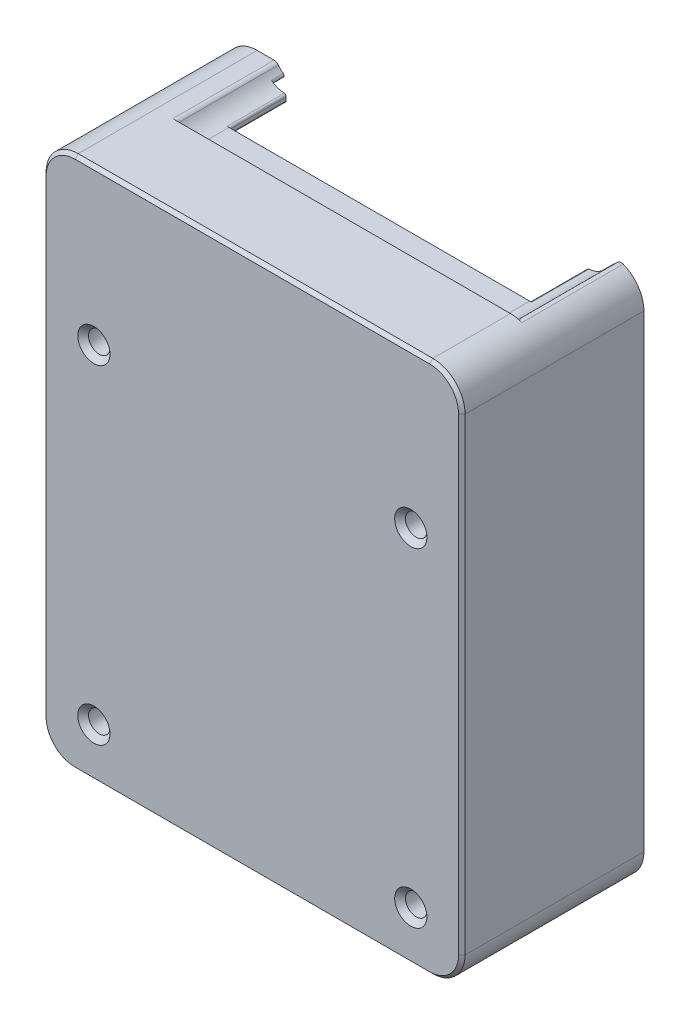
from build123d import *

# Parameters (mm, degrees)
EXTRUDE_1_DEPTH     = 2.45
EXTRUDE_START       = 13.5
SKETCH_2_R          = 1
EXTRUDE_2_DEPTH     = 13.5
EXTRUDE_START_2     = 1
SKETCH_3_R          = 1
EXTRUDE_3_DEPTH     = 1
SKETCH_4_W          = 23.9
SKETCH_4_H          = 5.2
CUT_EXTRUDE_1_DEPTH = 4
SKETCH_5_W          = 28
SKETCH_5_H          = 6.8
CUT_EXTRUDE_2_DEPTH = 4
SKETCH_6_R          = 1
CUT_EXTRUDE_3_DEPTH = 10
SKETCH_8_R          = 1
EXTRUDE_4_DEPTH     = 6
EXTRUDE_1_2_REACH   = 64.345
SKETCH_14_W         = 28
SKETCH_14_H         = 0.1
EXTRUDE_2_2_DEPTH   = 9.523664952
SKETCH_15_W         = 23.9
SKETCH_15_H         = 0.1
EXTRUDE_3_2_DEPTH   = 11.15
EXTRUDE_5_REACH     = 64.055
SKETCH_12_W         = 28
SKETCH_12_H         = 1.8
EXTRUDE_6_DEPTH     = 9.523664952
CUT_EXTRUDE_4_DEPTH = 9.426335048
FILLET_1_R          = 0.5
FILLET_2_R          = 0.2
FILLET_3_R          = 1.5
FILLET_4_R          = 2
CHAMFER_1_SIZE      = 0.3
CHAMFER_2_SIZE      = 0.5


with BuildPart() as part:
    # Эскиз1 → Extrude 1 (new body)
    with BuildSketch(Plane.XY):
        with BuildLine():
            Line((33.90958774, -47.3), (0.90958774, -47.3))
            ThreePointArc((0.90958774, -47.3), (-1.211732603, -46.421320344), (-2.09041226, -44.3))
            Line((-2.09041226, -44.3), (-2.09041226, -0.7))
            ThreePointArc((-2.09041226, -0.7), (-1.211732603, 1.421320344), (0.90958774, 2.3))
            Line((0.90958774, 2.3), (33.90958774, 2.3))
            ThreePointArc((33.90958774, 2.3), (36.030908084, 1.421320344), (36.90958774, -0.7))
            Line((36.90958774, -0.7), (36.90958774, -44.3))
            ThreePointArc((36.90958774, -44.3), (36.030908084, -46.421320344), (33.90958774, -47.3))
        make_face()
        with BuildLine():
            Line((33.80958774, -46.4), (1.00958774, -46.4))
            ThreePointArc((1.00958774, -46.4), (-0.546047178, -45.755634919), (-1.19041226, -44.2))
            Line((-1.19041226, -44.2), (-1.19041226, -0.8))
            ThreePointArc((-1.19041226, -0.8), (-0.546047178, 0.755634919), (1.00958774, 1.4))
            Line((1.00958774, 1.4), (33.80958774, 1.4))
            ThreePointArc((33.80958774, 1.4), (35.365222659, 0.755634919), (36.00958774, -0.8))
            Line((36.00958774, -0.8), (36.00958774, -44.2))
            ThreePointArc((36.00958774, -44.2), (35.365222659, -45.755634919), (33.80958774, -46.4))
        make_face(mode=Mode.SUBTRACT)
    extrude(amount=-EXTRUDE_1_DEPTH)

    # Эскиз2 → Extrude 2 (add)
    with BuildSketch(Plane.XY.offset(EXTRUDE_START)):
        with BuildLine():
            ThreePointArc((-2.09041226, -44.3), (-1.211732603, -46.421320344), (0.90958774, -47.3))
            Line((0.90958774, -47.3), (33.90958774, -47.3))
            ThreePointArc((33.90958774, -47.3), (36.030908084, -46.421320344), (36.90958774, -44.3))
            Line((36.90958774, -44.3), (36.90958774, -0.7))
            ThreePointArc((36.90958774, -0.7), (36.030908084, 1.421320344), (33.90958774, 2.3))
            Line((33.90958774, 2.3), (0.90958774, 2.3))
            ThreePointArc((0.90958774, 2.3), (-1.211732603, 1.421320344), (-2.09041226, -0.7))
            Line((-2.09041226, -0.7), (-2.09041226, -39.9))
            Line((-2.09041226, -39.9), (-2.09041226, -44.3))
        make_face()
        with Locations((2.65958774, -42.7)):
            Circle(SKETCH_2_R, mode=Mode.SUBTRACT)
        with Locations((2.65958774, -12.1)):
            Circle(SKETCH_2_R, mode=Mode.SUBTRACT)
        with BuildLine():
            Line((2.65958774, -39.9), (-1.19041226, -39.9))
            Line((-1.19041226, -39.9), (-1.19041226, -14.9))
            Line((-1.19041226, -14.9), (2.65958774, -14.9))
            ThreePointArc((2.65958774, -14.9), (5.45958774, -12.1), (2.65958774, -9.3))
            Line((2.65958774, -9.3), (-1.19041226, -9.3))
            Line((-1.19041226, -9.3), (-1.19041226, -0.8))
            ThreePointArc((-1.19041226, -0.8), (-0.546047178, 0.755634919), (1.00958774, 1.4))
            Line((1.00958774, 1.4), (33.80958774, 1.4))
            ThreePointArc((33.80958774, 1.4), (35.365222659, 0.755634919), (36.00958774, -0.8))
            Line((36.00958774, -0.8), (36.00958774, -39.9))
            Line((36.00958774, -39.9), (32.15958774, -39.9))
            ThreePointArc((32.15958774, -39.9), (30.179688753, -40.720101013), (29.35958774, -42.7))
            Line((29.35958774, -42.7), (29.35958774, -46.4))
            Line((29.35958774, -46.4), (5.45958774, -46.4))
            Line((5.45958774, -46.4), (5.45958774, -42.7))
            ThreePointArc((5.45958774, -42.7), (4.639486728, -40.720101013), (2.65958774, -39.9))
        make_face(mode=Mode.SUBTRACT)
        with Locations((32.15958774, -42.7)):
            Circle(SKETCH_2_R, mode=Mode.SUBTRACT)
    extrude(amount=-EXTRUDE_2_DEPTH)

    # Эскиз3 → Extrude 3 (add)
    with BuildSketch(Plane.XY.offset(13.5).offset(EXTRUDE_START_2)):
        with BuildLine():
            Line((-2.09041226, -0.7), (-2.09041226, -44.3))
            ThreePointArc((-2.09041226, -44.3), (-1.211732603, -46.421320344), (0.90958774, -47.3))
            Line((0.90958774, -47.3), (33.90958774, -47.3))
            ThreePointArc((33.90958774, -47.3), (36.030908084, -46.421320344), (36.90958774, -44.3))
            Line((36.90958774, -44.3), (36.90958774, -0.7))
            ThreePointArc((36.90958774, -0.7), (36.030908084, 1.421320344), (33.90958774, 2.3))
            Line((33.90958774, 2.3), (0.90958774, 2.3))
            ThreePointArc((0.90958774, 2.3), (-1.211732603, 1.421320344), (-2.09041226, -0.7))
        make_face()
        with Locations((2.65958774, -42.7)):
            Circle(SKETCH_3_R, mode=Mode.SUBTRACT)
        with Locations((2.65958774, -12.1)):
            Circle(SKETCH_3_R, mode=Mode.SUBTRACT)
        with Locations((32.15958774, -42.7)):
            Circle(SKETCH_3_R, mode=Mode.SUBTRACT)
    extrude(amount=-EXTRUDE_3_DEPTH)

    # Эскиз4 → Вырез-Вытянуть1 (cut)
    with BuildSketch(Plane.XZ.offset(47.3)):
        with Locations((17.40958774, -0.25)):
            Rectangle(SKETCH_4_W, SKETCH_4_H)
    extrude(amount=-CUT_EXTRUDE_1_DEPTH, mode=Mode.SUBTRACT)

    # Эскиз5 → Вырез-Вытянуть2 (cut)
    with BuildSketch(Plane(origin=(0, 2.3, 0), x_dir=(1, 0, 0), z_dir=(0, 1, 0))):
        with Locations((18.70958774, -0.576335048)):
            Rectangle(SKETCH_5_W, SKETCH_5_H)
    extrude(amount=-CUT_EXTRUDE_2_DEPTH, mode=Mode.SUBTRACT)

    # Эскиз6 → Вырез-Вытянуть3 (cut)
    with BuildSketch(Plane.XY.offset(14.5)):
        with Locations((32.15958774, -12.1)):
            Circle(SKETCH_6_R)
    extrude(amount=-CUT_EXTRUDE_3_DEPTH, mode=Mode.SUBTRACT)

    # Эскиз8 → Бобышка-Вытянуть4 (add)
    with BuildSketch(Plane(origin=(0, 0, 13.5), x_dir=(-1, 0, 0), z_dir=(0, 0, -1))):
        with BuildLine():
            Line((-32.15958774, -9.3), (-36.00958774, -9.3))
            Line((-36.00958774, -9.3), (-36.00958774, -14.9))
            Line((-36.00958774, -14.9), (-32.15958774, -14.9))
            ThreePointArc((-32.15958774, -14.9), (-29.35958774, -12.1), (-32.15958774, -9.3))
        make_face()
        with Locations(Location((-32.15958774, -12.1, 0), (0, 0, 180))):
            Circle(SKETCH_8_R, mode=Mode.SUBTRACT)
    extrude(amount=EXTRUDE_4_DEPTH)

    # Extrude 1 2: up to this face of the body (flat: up to its plane)
    extrude_1_2_end = Plane(part.part.faces().sort_by_distance((17.40958774, -21.902362375, 13.5))[0])
    # Эскиз13 → Extrude 1 2 (add, up to the picked face)
    with BuildSketch(Plane(origin=(0, 0, -2.45), x_dir=(-1, 0, 0), z_dir=(0, 0, -1)), mode=Mode.PRIVATE) as extrude_1_2_sk1:
        with BuildLine():
            Line((-5.45958774, -46.4), (-1.00958774, -46.4))
            ThreePointArc((-1.00958774, -46.4), (0.546047178, -45.755634919), (1.19041226, -44.2))
            Line((1.19041226, -44.2), (1.19041226, -0.8))
            ThreePointArc((1.19041226, -0.8), (0.546047178, 0.755634919), (-1.00958774, 1.4))
            Line((-1.00958774, 1.4), (-4.70958774, 1.4))
            Line((-4.70958774, 1.4), (-4.70958774, 1.3))
            Line((-4.70958774, 1.3), (-1.00958774, 1.3))
            ThreePointArc((-1.00958774, 1.3), (0.4753365, 0.68492424), (1.09041226, -0.8))
            Line((1.09041226, -0.8), (1.09041226, -44.2))
            ThreePointArc((1.09041226, -44.2), (0.4753365, -45.68492424), (-1.00958774, -46.3))
            Line((-1.00958774, -46.3), (-5.45958774, -46.3))
            Line((-5.45958774, -46.3), (-5.45958774, -46.4))
        make_face()
    extrude_1_2_tool1 = split(extrude(extrude_1_2_sk1.sketch, amount=-EXTRUDE_1_2_REACH, mode=Mode.PRIVATE), bisect_by=extrude_1_2_end, keep=Keep.BOTH, mode=Mode.PRIVATE)
    # Эскиз13 → Extrude 1 2 (add, up to the picked face)
    with BuildSketch(Plane(origin=(0, 0, -2.45), x_dir=(-1, 0, 0), z_dir=(0, 0, -1)), mode=Mode.PRIVATE) as extrude_1_2_sk2:
        with BuildLine():
            Line((-32.70958774, 1.4), (-33.80958774, 1.4))
            ThreePointArc((-33.80958774, 1.4), (-35.365222659, 0.755634919), (-36.00958774, -0.8))
            Line((-36.00958774, -0.8), (-36.00958774, -44.2))
            ThreePointArc((-36.00958774, -44.2), (-35.365222659, -45.755634919), (-33.80958774, -46.4))
            Line((-33.80958774, -46.4), (-29.35958774, -46.4))
            Line((-29.35958774, -46.4), (-29.35958774, -46.3))
            Line((-29.35958774, -46.3), (-33.80958774, -46.3))
            ThreePointArc((-33.80958774, -46.3), (-35.294511981, -45.68492424), (-35.90958774, -44.2))
            Line((-35.90958774, -44.2), (-35.90958774, -0.8))
            ThreePointArc((-35.90958774, -0.8), (-35.294511981, 0.68492424), (-33.80958774, 1.3))
            Line((-33.80958774, 1.3), (-32.70958774, 1.3))
            Line((-32.70958774, 1.3), (-32.70958774, 1.4))
        make_face()
    extrude_1_2_tool2 = split(extrude(extrude_1_2_sk2.sketch, amount=-EXTRUDE_1_2_REACH, mode=Mode.PRIVATE), bisect_by=extrude_1_2_end, keep=Keep.BOTH, mode=Mode.PRIVATE)
    add(extrude_1_2_tool1.solids().sort_by(Axis((-0.509462, -45.719049, -2.45), (0, 0, 1)))[0])
    add(extrude_1_2_tool2.solids().sort_by(Axis((35.328637, 0.719049, -2.45), (0, 0, 1)))[0])

    # Эскиз14 → Extrude 2 2 (add)
    with BuildSketch(Plane(origin=(0, 0, 3.976335048), x_dir=(-1, 0, 0), z_dir=(0, 0, -1))):
        with Locations((-18.70958774, 1.35)):
            Rectangle(SKETCH_14_W, SKETCH_14_H)
    extrude(amount=-EXTRUDE_2_2_DEPTH)

    # Эскиз15 → Extrude 3 2 (add)
    with BuildSketch(Plane(origin=(0, 0, 2.35), x_dir=(-1, 0, 0), z_dir=(0, 0, -1))):
        with Locations((-17.40958774, -46.35)):
            Rectangle(SKETCH_15_W, SKETCH_15_H)
    extrude(amount=-EXTRUDE_3_2_DEPTH)

    # Бобышка-Вытянуть5: up to this face of the body (flat: up to its plane)
    extrude_5_end = Plane(part.part.faces().sort_by_distance((17.40958774, -21.923561219, 13.5))[0])
    # Эскиз9 → Бобышка-Вытянуть5 (add, up to the picked face)
    with BuildSketch(Plane(origin=(0, 0, -1.35), x_dir=(-1, 0, 0), z_dir=(0, 0, -1)), mode=Mode.PRIVATE) as extrude_5_sk1:
        with BuildLine():
            Line((-0.810040229, -46.290497738), (-2.875769072, -46.290497738))
            ThreePointArc((-2.875769072, -46.290497738), (-2.07721679, -46.124159171), (-1.41149455, -45.652811991))
            ThreePointArc((-1.41149455, -45.652811991), (-0.121659652, -45.007207353), (0.398460201, -43.661861765))
            ThreePointArc((0.398460201, -43.661861765), (0.909216246, -42.980750675), (1.09041226, -42.148914118))
            Line((1.09041226, -42.148914118), (1.09041226, -44.2))
            ThreePointArc((1.09041226, -44.2), (0.544286414, -45.612612867), (-0.810040229, -46.290497738))
        make_face()
    extrude_5_tool1 = split(extrude(extrude_5_sk1.sketch, amount=-EXTRUDE_5_REACH, mode=Mode.PRIVATE), bisect_by=extrude_5_end, keep=Keep.BOTH, mode=Mode.PRIVATE)
    # Эскиз9 → Бобышка-Вытянуть5 (add, up to the picked face)
    with BuildSketch(Plane(origin=(0, 0, -1.35), x_dir=(-1, 0, 0), z_dir=(0, 0, -1)), mode=Mode.PRIVATE) as extrude_5_sk2:
        with BuildLine():
            Line((-35.90958774, -44.2), (-35.90958774, -42.148914118))
            ThreePointArc((-35.90958774, -42.148914118), (-35.728391727, -42.980750675), (-35.217635682, -43.661861765))
            ThreePointArc((-35.217635682, -43.661861765), (-34.697515829, -45.007207353), (-33.407680931, -45.652811991))
            ThreePointArc((-33.407680931, -45.652811991), (-32.741958691, -46.124159171), (-31.943406409, -46.290497738))
            Line((-31.943406409, -46.290497738), (-34.009135252, -46.290497738))
            ThreePointArc((-34.009135252, -46.290497738), (-35.363461895, -45.612612867), (-35.90958774, -44.2))
        make_face()
    extrude_5_tool2 = split(extrude(extrude_5_sk2.sketch, amount=-EXTRUDE_5_REACH, mode=Mode.PRIVATE), bisect_by=extrude_5_end, keep=Keep.BOTH, mode=Mode.PRIVATE)
    # Эскиз9 → Бобышка-Вытянуть5 (add, up to the picked face)
    with BuildSketch(Plane(origin=(0, 0, -1.35), x_dir=(-1, 0, 0), z_dir=(0, 0, -1)), mode=Mode.PRIVATE) as extrude_5_sk3:
        with BuildLine():
            Line((-32.70958774, 0.5), (-33.30958774, 0.5))
            ThreePointArc((-33.30958774, 0.5), (-34.582379947, -0.027207794), (-35.10958774, -1.3))
            Line((-35.10958774, -1.3), (-35.10958774, -1.7))
            ThreePointArc((-35.10958774, -1.7), (-35.698442122, -2.405572809), (-35.90958774, -3.3))
            Line((-35.90958774, -3.3), (-36.90958774, -0.7))
            ThreePointArc((-36.90958774, -0.7), (-36.030908084, 1.421320344), (-33.90958774, 2.3))
            Line((-33.90958774, 2.3), (-32.70958774, 2.3))
            Line((-32.70958774, 2.3), (-32.70958774, 1.2))
            Line((-32.70958774, 1.2), (-32.70958774, 0.5))
        make_face()
    extrude_5_tool3 = split(extrude(extrude_5_sk3.sketch, amount=-EXTRUDE_5_REACH, mode=Mode.PRIVATE), bisect_by=extrude_5_end, keep=Keep.BOTH, mode=Mode.PRIVATE)
    # Эскиз9 → Бобышка-Вытянуть5 (add, up to the picked face)
    with BuildSketch(Plane(origin=(0, 0, -1.35), x_dir=(-1, 0, 0), z_dir=(0, 0, -1)), mode=Mode.PRIVATE) as extrude_5_sk4:
        with BuildLine():
            Line((-1.50958774, 0.5), (-4.70958774, 0.5))
            Line((-4.70958774, 0.5), (-4.70958774, 1.2))
            Line((-4.70958774, 1.2), (-4.70958774, 2.3))
            Line((-4.70958774, 2.3), (-0.90958774, 2.3))
            ThreePointArc((-0.90958774, 2.3), (1.211732603, 1.421320344), (2.09041226, -0.7))
            Line((2.09041226, -0.7), (1.09041226, -3.3))
            ThreePointArc((1.09041226, -3.3), (0.879266642, -2.405572809), (0.29041226, -1.7))
            Line((0.29041226, -1.7), (0.29041226, -1.3))
            ThreePointArc((0.29041226, -1.3), (-0.236795534, -0.027207794), (-1.50958774, 0.5))
        make_face()
    extrude_5_tool4 = split(extrude(extrude_5_sk4.sketch, amount=-EXTRUDE_5_REACH, mode=Mode.PRIVATE), bisect_by=extrude_5_end, keep=Keep.BOTH, mode=Mode.PRIVATE)
    add(extrude_5_tool1.solids().sort_by(Axis((0.020604, -45.07512, -1.35), (0, 0, 1)))[0])
    add(extrude_5_tool2.solids().sort_by(Axis((34.798571, -45.07512, -1.35), (0, 0, 1)))[0])
    add(extrude_5_tool3.solids().sort_by(Axis((35.039178, 0.318061, -1.35), (0, 0, 1)))[0])
    add(extrude_5_tool4.solids().sort_by(Axis((0.865444, 0.64162, -1.35), (0, 0, 1)))[0])

    # Эскиз12 → Бобышка-Вытянуть6 (add)
    with BuildSketch(Plane(origin=(0, 0, 3.976335048), x_dir=(-1, 0, 0), z_dir=(0, 0, -1))):
        with Locations((-18.70958774, 1.4)):
            Rectangle(SKETCH_12_W, SKETCH_12_H)
    extrude(amount=-EXTRUDE_6_DEPTH)

    # Эскиз11 → Вырез-Вытянуть4 (cut)
    with BuildSketch(Plane(origin=(0, 0, -2.45), x_dir=(-1, 0, 0), z_dir=(0, 0, -1))):
        with BuildLine():
            Line((-35.009968097, 3.500380356), (-2.409207384, 3.500380356))
            ThreePointArc((-2.409207384, 3.500380356), (-3.082973191, 1.873765807), (-4.70958774, 1.2))
            Line((-4.70958774, 1.2), (-32.70958774, 1.2))
            ThreePointArc((-32.70958774, 1.2), (-34.33620229, 1.873765807), (-35.009968097, 3.500380356))
        make_face()
    extrude(amount=-CUT_EXTRUDE_4_DEPTH, mode=Mode.SUBTRACT)

    # Скругление1
    fillet_1_edges = [part.edges().sort_by_distance(p)[0] for p in [
        (35.10958774, -1.7, 6.075),
        (-0.29041226, -1.7, 6.075),
        (1.41149455, -45.652811991, -0.675),
        (-0.398460201, -43.661861765, -0.675),
        (33.407680931, -45.652811991, -0.675),
        (35.217635682, -43.661861765, -0.675),
        (34.61753128, 2.215272877, 2.263167524),
        (2.747232833, 2.3, 2.263167524),
    ]]
    fillet(fillet_1_edges, radius=FILLET_1_R)

    # Скругление2
    # the kernel refuses this fillet: 0.2 mm, written as the material it takes off along each edge
    with BuildSketch(Plane(origin=(29.35958774, -47.3, -2.95), x_dir=(1, 0, 0), z_dir=(0, 0, 1))) as fillet_2_piece_1:
        with BuildLine():
            CenterArc((FILLET_2_R, FILLET_2_R), FILLET_2_R, 180, 90)
            Line((0, FILLET_2_R), (0, 0))
            Line((0, 0), (FILLET_2_R, 0))
        make_face()
    extrude(amount=5.3, mode=Mode.SUBTRACT)
    with BuildSketch(Plane(origin=(5.45958774, -47.3, 2.35), x_dir=(0, 1, 0), z_dir=(0, 0, -1))) as fillet_2_piece_2:
        with BuildLine():
            CenterArc((FILLET_2_R, -FILLET_2_R), FILLET_2_R, 90, 90)
            Line((0, -FILLET_2_R), (0, 0))
            Line((0, 0), (FILLET_2_R, 0))
        make_face()
    extrude(amount=5.3, mode=Mode.SUBTRACT)
    with BuildSketch(Plane(origin=(29.35958774, -46.3, -2.95), x_dir=(0, -1, 0), z_dir=(0, 0, 1))) as fillet_2_piece_3:
        with BuildLine():
            CenterArc((FILLET_2_R, FILLET_2_R), FILLET_2_R, 180, 90)
            Line((0, FILLET_2_R), (0, 0))
            Line((0, 0), (FILLET_2_R, 0))
        make_face()
    extrude(amount=2.95, mode=Mode.SUBTRACT)
    with BuildSketch(Plane(origin=(5.45958774, -46.3, -2.95), x_dir=(0, -1, 0), z_dir=(0, 0, 1))) as fillet_2_piece_4:
        with BuildLine():
            CenterArc((FILLET_2_R, -FILLET_2_R), FILLET_2_R, 90, 90)
            Line((0, -FILLET_2_R), (0, 0))
            Line((0, 0), (FILLET_2_R, 0))
        make_face()
    extrude(amount=2.95, mode=Mode.SUBTRACT)
    with BuildSketch(Plane(origin=(4.70958774, 0.5, -1.85), x_dir=(0, 1, 0), z_dir=(0, 0, 1))) as fillet_2_piece_5:
        with BuildLine():
            CenterArc((FILLET_2_R, FILLET_2_R), FILLET_2_R, 180, 90)
            Line((0, FILLET_2_R), (0, 0))
            Line((0, 0), (FILLET_2_R, 0))
        make_face()
    extrude(amount=5.826335048, mode=Mode.SUBTRACT)
    with BuildSketch(Plane(origin=(32.70958774, 0.5, -1.85), x_dir=(0, 1, 0), z_dir=(0, 0, 1))) as fillet_2_piece_6:
        with BuildLine():
            CenterArc((FILLET_2_R, -FILLET_2_R), FILLET_2_R, 90, 90)
            Line((0, -FILLET_2_R), (0, 0))
            Line((0, 0), (FILLET_2_R, 0))
        make_face()
    extrude(amount=5.826335048, mode=Mode.SUBTRACT)
    with BuildSketch(Plane(origin=(32.70958774, 1.2, -1.829970954), x_dir=(0.9991986389527051, 0.04002599049444876, 0), z_dir=(0, 0, 1))) as fillet_2_piece_7:
        with BuildLine():
            CenterArc((0.192155203, -0.199839728), FILLET_2_R, 92.293933115, 85.412133771)
            Line((-0.007684525, -0.19183453), (0, 0))
            ThreePointArc((0, 0), (0.092075002, -0.001843435), (0.184150005, 0))
        make_face()
    extrude(amount=5.806306003, mode=Mode.SUBTRACT)
    with BuildSketch(Plane(origin=(33.380464831, 1.3, -1.35), x_dir=(0.8960288021219349, 0.44399592990018566, 0), z_dir=(0, 0, -1))) as fillet_2_piece_8:
        with BuildLine():
            CenterArc((0.784345329, 0.197312663), FILLET_2_R, 125.396442752, 135.200454718)
            Line((0.668499217, 0.360345415), (0.656914605, 0.37664869))
            ThreePointArc((0.656914605, 0.37664869), (0.375626567, 0.208449401), (-0.008879919, 0.017920576))
            Line((-0.008879919, 0.017920576), (0.003267588, -0.019731266))
            ThreePointArc((0.003267588, -0.019731266), (0.375834726, 0.010909484), (0.748401865, -0.019731266))
            Line((0.748401865, -0.019731266), (0.751669452, 0))
        make_face()
    extrude(amount=2.998585033, mode=Mode.SUBTRACT)
    with BuildSketch(Plane(origin=(4.038710649, 1.3, -1.35), x_dir=(-1, 0, 0), z_dir=(0, 0, -1))) as fillet_2_piece_9:
        with BuildLine():
            CenterArc((0.829249689, 0.2), FILLET_2_R, 126.866992282, 143.133007718)
            ThreePointArc((0.709257803, 0.360006085), (0.370306675, 0.149115832), (0, 0))
            Line((0, 0), (0.829249689, 0))
        make_face()
    extrude(amount=3.173124223, mode=Mode.SUBTRACT)
    with BuildSketch(Plane(origin=(4.70958774, 1.2, -1.829970954), x_dir=(0, -1, 0), z_dir=(0, 0, 1))) as fillet_2_piece_10:
        with BuildLine():
            CenterArc((0.191988382, -0.2), FILLET_2_R, 90, 85.41213377)
            ThreePointArc((-0.007370786, -0.184002434), (-0.001843435, -0.092075002), (0, 0))
            Line((0, 0), (0.191988382, 0))
        make_face()
    extrude(amount=5.806306003, mode=Mode.SUBTRACT)

    # Скругление3
    fillet_3_edges = [part.edges().sort_by_distance(p)[0] for p in [
        (35.90958774, -39.9, 6.75),
        (-1.09041226, -9.3, 6.75),
        (-1.09041226, -39.9, 6.75),
        (-1.09041226, -14.9, 6.75),
        (29.35958774, -46.3, 7.925),
        (5.45958774, -46.3, 7.925),
    ]]
    fillet(fillet_3_edges, radius=FILLET_3_R)

    # Скругление4
    fillet_4_edges = [part.edges().sort_by_distance(p)[0] for p in [
        (35.90958774, -14.9, 10.5),
        (35.90958774, -9.3, 10.5),
    ]]
    fillet(fillet_4_edges, radius=FILLET_4_R)

    # Фаска1
    chamfer_1_edges = [part.edges().sort_by_distance(p)[0] for p in [
        (-1.211732603, 1.421320344, 14.5),
        (-2.09041226, -22.5, 14.5),
        (-1.211732603, -46.421320344, 14.5),
        (17.40958774, -47.3, 14.5),
        (36.030908084, -46.421320344, 14.5),
        (36.90958774, -22.5, 14.5),
        (36.030908084, 1.421320344, 14.5),
        (17.40958774, 2.3, 14.5),
    ]]
    chamfer(chamfer_1_edges, length=CHAMFER_1_SIZE)

    # Фаска2
    chamfer_2_edges = [part.edges().sort_by_distance(p)[0] for p in [
        (1.65958774, -42.7, 14.5),
        (1.65958774, -12.1, 14.5),
        (31.15958774, -42.7, 14.5),
        (31.15958774, -12.1, 14.5),
    ]]
    chamfer(chamfer_2_edges, length=CHAMFER_2_SIZE)


solid = part.part
